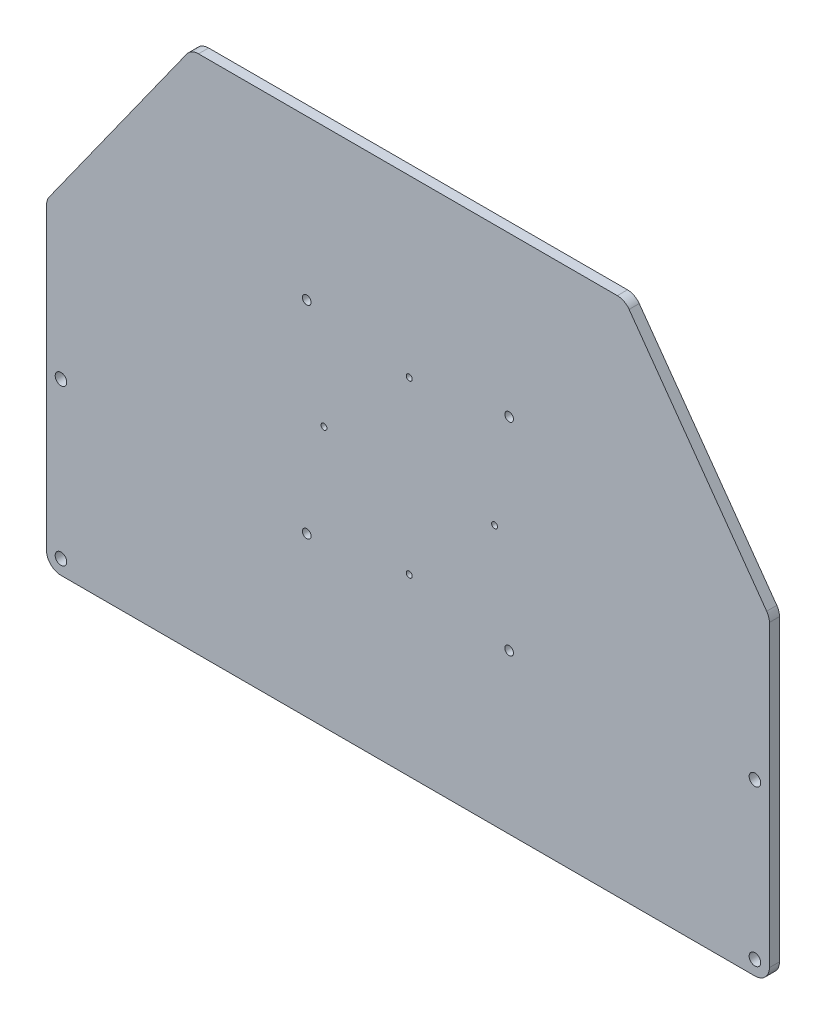
from build123d import *

# Parameters (mm, degrees)
BOSS_EXTRU_1_DEPTH           = 3.5
ESQUISSE2_R                  = 2
ENL_V_MAT_EXTRU_1_DEPTH      = 395.382111663
ENL_V_MAT_EXTRU_2_DEPTH      = 395.382111663
ENL_V_MAT_EXTRU_2_DEPTH_BACK = 395.382111663
CONG_1_R                     = 5
ESQUISSE4_R                  = 1.5
ENL_V_MAT_EXTRU_3_DEPTH      = 309.078317965
ESQUISSE5_R                  = 1.025
ENL_V_MAT_EXTRU_4_DEPTH      = 309.078317965


with BuildPart() as part:
    # Esquisse1 → Boss.-Extru.1 (new body)
    with BuildSketch(Plane.XY):
        with BuildLine():
            Line((5, 0), (245, 0))
            ThreePointArc((245, 0), (248.535533906, 1.464466094), (250, 5))
            Line((250, 5), (250, 305))
            Line((250, 305), (0, 305))
            Line((0, 305), (0, 5))
            ThreePointArc((0, 5), (1.464466094, 1.464466094), (5, 0))
        make_face()
    extrude(amount=BOSS_EXTRU_1_DEPTH)

    # Esquisse2 → Enlèv. mat.-Extru.1 (cut, through all)
    with BuildSketch(Plane.XY.offset(3.5)):
        with Locations((5, 5)):
            Circle(ESQUISSE2_R)
        with Locations((245, 5)):
            Circle(ESQUISSE2_R)
        with Locations((5, 58.8)):
            Circle(ESQUISSE2_R)
        with Locations((245, 58.8)):
            Circle(ESQUISSE2_R)
    extrude(amount=-ENL_V_MAT_EXTRU_1_DEPTH, mode=Mode.SUBTRACT)

    # Esquisse3 → Enlèv. mat.-Extru.2 (cut, two sides: drawn at the far end of the back side and taken through both)
    with BuildSketch(Plane.XY.offset(3.5).offset(-ENL_V_MAT_EXTRU_2_DEPTH_BACK)):
        Polygon((-374.383398967, -414.136758554), (0, 110), (50, 180), (200, 180), (250, 110), (624.383398967, -414.136758554), (624.383398967, 874.090350445), (-374.383398967, 874.090350445), align=None)
    extrude(amount=ENL_V_MAT_EXTRU_2_DEPTH + ENL_V_MAT_EXTRU_2_DEPTH_BACK, mode=Mode.SUBTRACT)

    # Congé1
    cong_1_edges = [part.edges().sort_by_distance(p)[0] for p in [
        (250, 110, 1.75),
        (200, 180, 1.75),
        (50, 180, 1.75),
        (0, 110, 1.75),
    ]]
    fillet(cong_1_edges, radius=CONG_1_R)

    # Esquisse4 → Enlèv. mat.-Extru.3 (cut, through all)
    with BuildSketch(Plane(origin=(0, 0, 0), x_dir=(-1, 0, 0), z_dir=(0, 0, -1))):
        with Locations((-160, 55)):
            Circle(ESQUISSE4_R)
        with Locations((-160, 125)):
            Circle(ESQUISSE4_R)
        with Locations((-90, 125)):
            Circle(ESQUISSE4_R)
        with Locations((-90, 55)):
            Circle(ESQUISSE4_R)
    extrude(amount=-ENL_V_MAT_EXTRU_3_DEPTH, mode=Mode.SUBTRACT)

    # Esquisse5 → Enlèv. mat.-Extru.4 (cut, through all)
    with BuildSketch(Plane(origin=(0, 0, 0), x_dir=(-1, 0, 0), z_dir=(0, 0, -1))):
        with Locations((-154.962016237, 90.000989814)):
            Circle(ESQUISSE5_R)
        with Locations((-95.962016237, 90.000989814)):
            Circle(ESQUISSE5_R)
        with Locations((-125.462016237, 119.501979628)):
            Circle(ESQUISSE5_R)
        with Locations((-125.462016237, 60.5)):
            Circle(ESQUISSE5_R)
    extrude(amount=-ENL_V_MAT_EXTRU_4_DEPTH, mode=Mode.SUBTRACT)


solid = part.part
